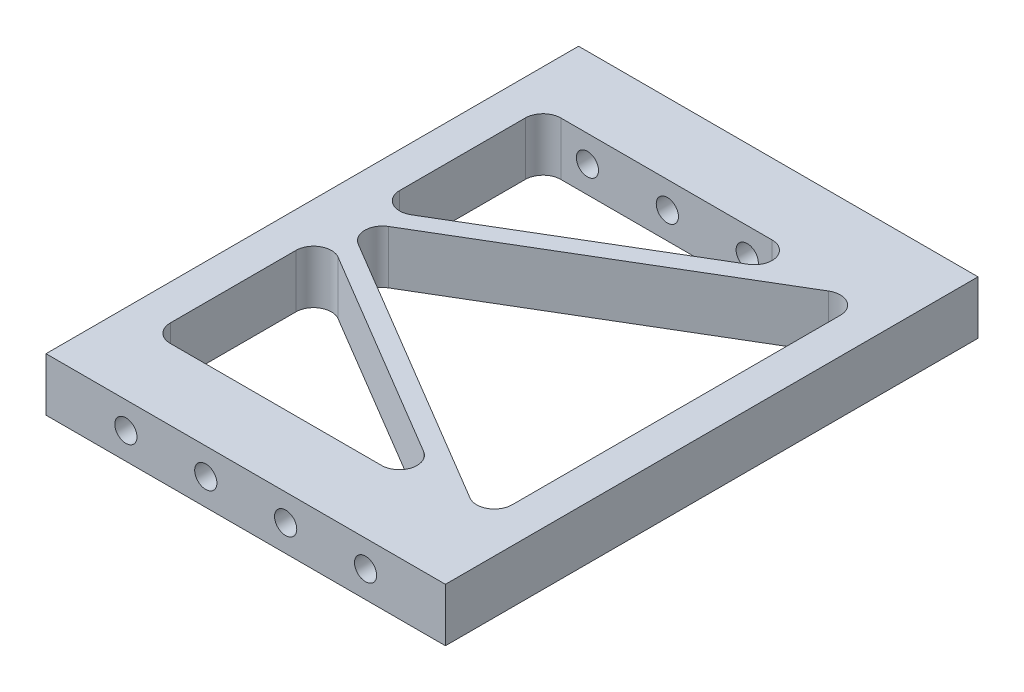
from build123d import *

# Parameters (mm, degrees)
SKETCH_1_W          = 45
SKETCH_1_H          = 60
EXTRUDE_1_DEPTH     = 6
CUT_EXTRUDE_2_DEPTH = 65.360313859
FILLET_1_R          = 2
M3X0_52_D           = 2.5
M3X0_52_DEPTH       = 8.5
M3X0_52_TIP         = 0.751075774
M3X0_51_D           = 2.5
M3X0_51_DEPTH       = 8.5
M3X0_51_TIP         = 0.751075774


with BuildPart() as part:
    # Эскиз1 → Бобышка-Вытянуть1 (new body)
    with BuildSketch(Plane(origin=(0, 0, 0), x_dir=(1, 0, 0), z_dir=(0, 1, 0))):
        with Locations((0, -30)):
            Rectangle(SKETCH_1_W, SKETCH_1_H)
    extrude(amount=EXTRUDE_1_DEPTH)

    # Эскиз13 → Вырез-Вытянуть2 (cut, through all)
    with BuildSketch(Plane(origin=(0, 6, 0), x_dir=(1, 0, 0), z_dir=(0, 1, 0))):
        Polygon((-18.5, -27.673162892), (14.586683045, -8), (-18.5, -8), align=None)
        Polygon((-18.5, -30), (18.5, -8), (18.5, -52), align=None)
        Polygon((-18.5, -32.326837108), (14.586683045, -52), (-18.5, -52), align=None)
    extrude(amount=-CUT_EXTRUDE_2_DEPTH, mode=Mode.SUBTRACT)

    # Скругление1
    fillet_1_edges = [part.edges().sort_by_distance(p)[0] for p in [
        (-18.5, 3, 52),
        (18.5, 3, 52),
        (18.5, 3, 8),
        (-18.5, 3, 27.673162892),
        (-18.5, 3, 8),
        (-18.5, 3, 30),
        (-18.5, 3, 32.326837108),
        (14.586683045, 3, 8),
        (14.586683045, 3, 52),
    ]]
    fillet(fillet_1_edges, radius=FILLET_1_R)

    # Отверстие обработанное метчиком M3x0.52
    with Locations(Plane(origin=(0, 0, 0), x_dir=(-1, 0, 0), z_dir=(0, 0, -1))):
        with Locations((-13.5, 3), (-4.5, 3), (4.5, 3), (13.5, 3)):
            Hole(M3X0_52_D / 2, depth=M3X0_52_DEPTH)
            with Locations((0, 0, -(M3X0_52_DEPTH + M3X0_52_TIP / 2))):  # 118° drill point
                Cone(0, M3X0_52_D / 2, M3X0_52_TIP, mode=Mode.SUBTRACT)

    # Отверстие обработанное метчиком M3x0.51
    with Locations(Plane.XY.offset(60)):
        with Locations((-13.5, 3), (-4.5, 3), (4.5, 3), (13.5, 3)):
            Hole(M3X0_51_D / 2, depth=M3X0_51_DEPTH)
            with Locations((0, 0, -(M3X0_51_DEPTH + M3X0_51_TIP / 2))):  # 118° drill point
                Cone(0, M3X0_51_D / 2, M3X0_51_TIP, mode=Mode.SUBTRACT)


solid = part.part
